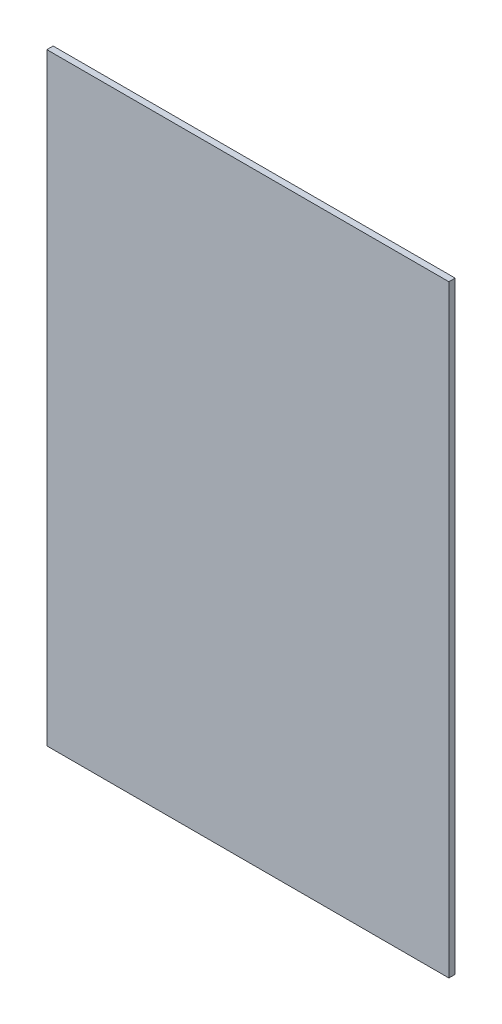
from build123d import *

# Parameters (mm, degrees)
SKETCH1_W           = 203.2
SKETCH1_H           = 304.8
BOSS_EXTRUDE1_DEPTH = 3.175


with BuildPart() as part:
    # Sketch1 → Boss-Extrude1 (new body)
    with BuildSketch(Plane.XY):
        with Locations((101.6, 152.4)):
            Rectangle(SKETCH1_W, SKETCH1_H)
    extrude(amount=BOSS_EXTRUDE1_DEPTH)


solid = part.part
